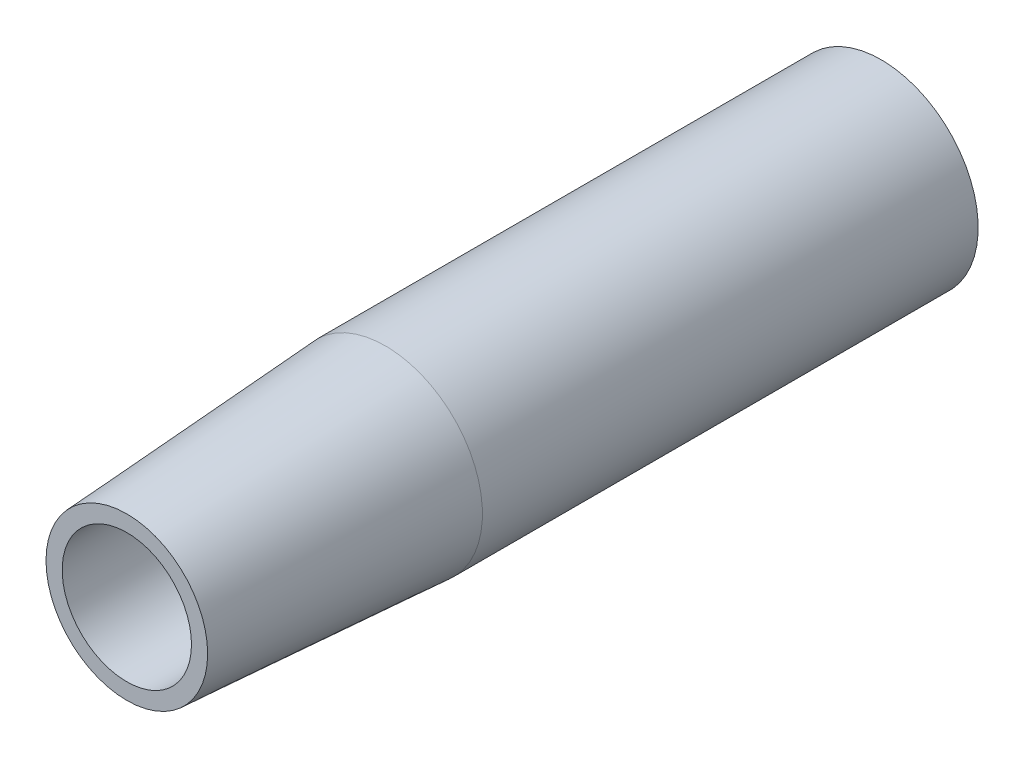
from build123d import *

# Parameters (mm, degrees)
SKETCH_1_R          = 15
EXTRUDE_1_DEPTH     = 77
SKETCH_3_R          = 12.5
SKETCH_2_R          = 15
SKETCH_5_R          = 10
CUT_EXTRUDE_1_DEPTH = 60
CUT_EXTRUDE_START   = -40.5
SKETCH_6_R          = 10
CUT_EXTRUDE_2_DEPTH = 40.5
CHAMFER_1_SIZE      = 3.5
CHAMFER_1_SIZE2     = 6.062177826
CHAMFER_2_SIZE      = 2.732050808
CHAMFER_2_SIZE_2    = 1


with BuildPart() as part:
    # 스케치1 → 보스-돌출1 (new body)
    with BuildSketch(Plane.XY):
        Circle(SKETCH_1_R)
    extrude(amount=EXTRUDE_1_DEPTH)

    # 스케치3 → 로프트1 section 0
    with BuildSketch(Plane.XY.offset(117)):
        Circle(SKETCH_3_R)
    # 스케치2 → 로프트1 section 1
    with BuildSketch(Plane.XY.offset(77)):
        Circle(SKETCH_2_R)
    loft()

    # 스케치5 → 컷-돌출1 (cut)
    with BuildSketch(Plane.XY.offset(117)):
        Circle(SKETCH_5_R)
    extrude(amount=-CUT_EXTRUDE_1_DEPTH, mode=Mode.SUBTRACT)

    # 스케치6 → 컷-돌출2 (cut)
    with BuildSketch(Plane(origin=(0, 0, 0), x_dir=(-1, 0, 0), z_dir=(0, 0, -1)).offset(CUT_EXTRUDE_START)):
        with Locations(Location((0, 0, 0), (0, 0, 180))):
            Circle(SKETCH_6_R)
    extrude(amount=CUT_EXTRUDE_2_DEPTH, mode=Mode.SUBTRACT)

    # 모따기1
    chamfer_1_edges = [part.edges().sort_by_distance(p)[0] for p in [
        (-10, 0, 0),
    ]]
    chamfer_1_side = [part.faces().sort_by_distance(p)[0] for p in [
        (-14.575735931, 0, 0),
    ]]
    chamfer(chamfer_1_edges, length=CHAMFER_1_SIZE, length2=CHAMFER_1_SIZE2, reference=chamfer_1_side[0])

    # 모따기2
    # the kernel refuses this chamfer: 2.732050808, 1 mm, written as the material it takes off along each edge
    with BuildSketch(Plane(origin=(0, 0, 0), x_dir=(1, 0, 0), z_dir=(0, 1, 0))) as chamfer_2_piece_1:
        Polygon((13.5 + CHAMFER_2_SIZE, 0), (13.5 - CHAMFER_2_SIZE_2 * 0.5, -CHAMFER_2_SIZE_2 * 0.866025403784), (13.5, 0), align=None)
    revolve(axis=Axis((0, 0, 0), (0, 0, -1)), mode=Mode.SUBTRACT)


solid = part.part
